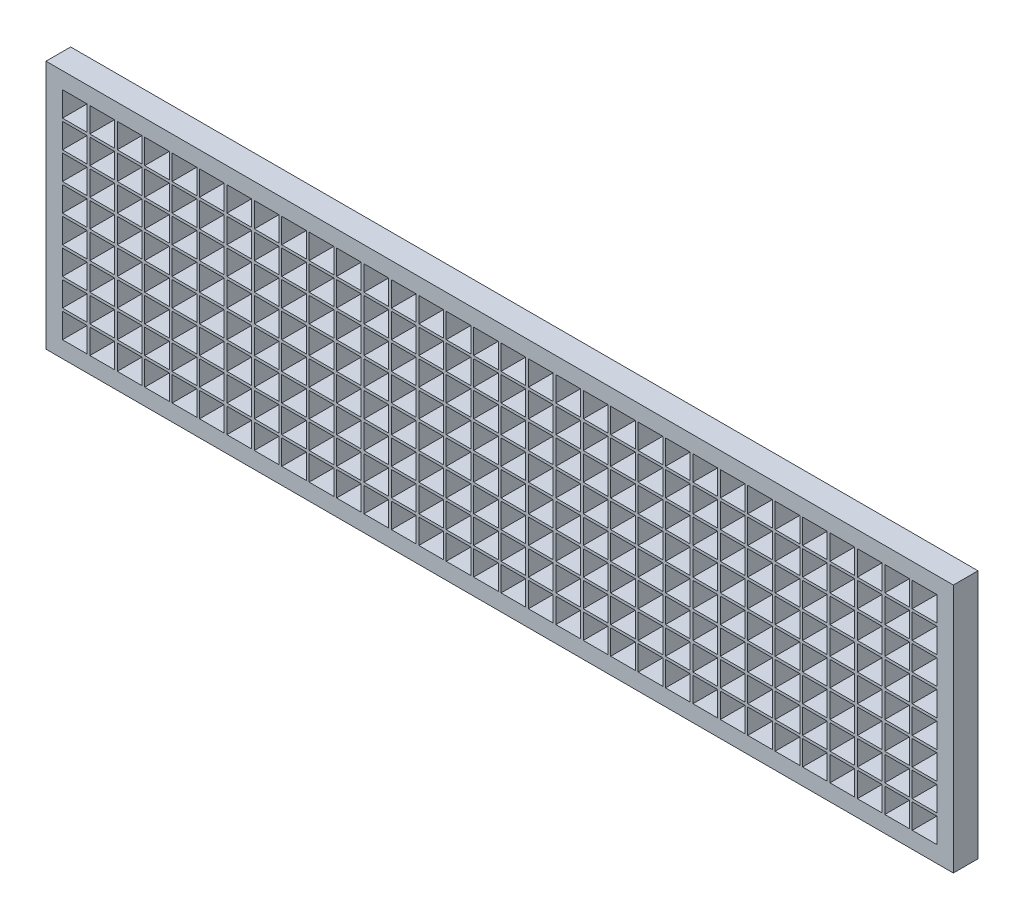
from build123d import *

# Parameters (mm, degrees)
SKETCH_1_W      = 165.5
SKETCH_1_H      = 45.5
SKETCH_1_W_2    = 4.5
SKETCH_1_H_2    = 4.5
EXTRUDE_1_DEPTH = 4.5


with BuildPart() as part:
    # 草图1 → 凸台-拉伸1 (new body)
    with BuildSketch(Plane.XY):
        with Locations((52.859756098, 21.231707317)):
            Rectangle(SKETCH_1_W, SKETCH_1_H)
        with Locations((-24.640243902, 3.731707317)):
            Rectangle(SKETCH_1_W_2, SKETCH_1_H_2, mode=Mode.SUBTRACT)
        with Locations((-19.640243902, 3.731707317)):
            Rectangle(SKETCH_1_W_2, SKETCH_1_H_2, mode=Mode.SUBTRACT)
        with Locations((-14.640243902, 3.731707317)):
            Rectangle(SKETCH_1_W_2, SKETCH_1_H_2, mode=Mode.SUBTRACT)
        with Locations((-9.640243902, 3.731707317)):
            Rectangle(SKETCH_1_W_2, SKETCH_1_H_2, mode=Mode.SUBTRACT)
        with Locations((-4.640243902, 3.731707317)):
            Rectangle(SKETCH_1_W_2, SKETCH_1_H_2, mode=Mode.SUBTRACT)
        with Locations((0.359756098, 3.731707317)):
            Rectangle(SKETCH_1_W_2, SKETCH_1_H_2, mode=Mode.SUBTRACT)
        with Locations((5.359756098, 3.731707317)):
            Rectangle(SKETCH_1_W_2, SKETCH_1_H_2, mode=Mode.SUBTRACT)
        with Locations((10.359756098, 3.731707317)):
            Rectangle(SKETCH_1_W_2, SKETCH_1_H_2, mode=Mode.SUBTRACT)
        with Locations((-24.640243902, 8.731707317)):
            Rectangle(SKETCH_1_W_2, SKETCH_1_H_2, mode=Mode.SUBTRACT)
        with Locations((-19.640243902, 8.731707317)):
            Rectangle(SKETCH_1_W_2, SKETCH_1_H_2, mode=Mode.SUBTRACT)
        with Locations((-14.640243902, 8.731707317)):
            Rectangle(SKETCH_1_W_2, SKETCH_1_H_2, mode=Mode.SUBTRACT)
        with Locations((-9.640243902, 8.731707317)):
            Rectangle(SKETCH_1_W_2, SKETCH_1_H_2, mode=Mode.SUBTRACT)
        with Locations((-4.640243902, 8.731707317)):
            Rectangle(SKETCH_1_W_2, SKETCH_1_H_2, mode=Mode.SUBTRACT)
        with Locations((0.359756098, 8.731707317)):
            Rectangle(SKETCH_1_W_2, SKETCH_1_H_2, mode=Mode.SUBTRACT)
        with Locations((5.359756098, 8.731707317)):
            Rectangle(SKETCH_1_W_2, SKETCH_1_H_2, mode=Mode.SUBTRACT)
        with Locations((10.359756098, 8.731707317)):
            Rectangle(SKETCH_1_W_2, SKETCH_1_H_2, mode=Mode.SUBTRACT)
        with Locations((15.359756098, 3.731707317)):
            Rectangle(SKETCH_1_W_2, SKETCH_1_H_2, mode=Mode.SUBTRACT)
        with Locations((20.359756098, 3.731707317)):
            Rectangle(SKETCH_1_W_2, SKETCH_1_H_2, mode=Mode.SUBTRACT)
        with Locations((25.359756098, 3.731707317)):
            Rectangle(SKETCH_1_W_2, SKETCH_1_H_2, mode=Mode.SUBTRACT)
        with Locations((30.359756098, 3.731707317)):
            Rectangle(SKETCH_1_W_2, SKETCH_1_H_2, mode=Mode.SUBTRACT)
        with Locations((35.359756098, 3.731707317)):
            Rectangle(SKETCH_1_W_2, SKETCH_1_H_2, mode=Mode.SUBTRACT)
        with Locations((40.359756098, 3.731707317)):
            Rectangle(SKETCH_1_W_2, SKETCH_1_H_2, mode=Mode.SUBTRACT)
        with Locations((45.359756098, 3.731707317)):
            Rectangle(SKETCH_1_W_2, SKETCH_1_H_2, mode=Mode.SUBTRACT)
        with Locations((50.359756098, 3.731707317)):
            Rectangle(SKETCH_1_W_2, SKETCH_1_H_2, mode=Mode.SUBTRACT)
        with Locations((15.359756098, 8.731707317)):
            Rectangle(SKETCH_1_W_2, SKETCH_1_H_2, mode=Mode.SUBTRACT)
        with Locations((20.359756098, 8.731707317)):
            Rectangle(SKETCH_1_W_2, SKETCH_1_H_2, mode=Mode.SUBTRACT)
        with Locations((25.359756098, 8.731707317)):
            Rectangle(SKETCH_1_W_2, SKETCH_1_H_2, mode=Mode.SUBTRACT)
        with Locations((30.359756098, 8.731707317)):
            Rectangle(SKETCH_1_W_2, SKETCH_1_H_2, mode=Mode.SUBTRACT)
        with Locations((35.359756098, 8.731707317)):
            Rectangle(SKETCH_1_W_2, SKETCH_1_H_2, mode=Mode.SUBTRACT)
        with Locations((40.359756098, 8.731707317)):
            Rectangle(SKETCH_1_W_2, SKETCH_1_H_2, mode=Mode.SUBTRACT)
        with Locations((45.359756098, 8.731707317)):
            Rectangle(SKETCH_1_W_2, SKETCH_1_H_2, mode=Mode.SUBTRACT)
        with Locations((50.359756098, 8.731707317)):
            Rectangle(SKETCH_1_W_2, SKETCH_1_H_2, mode=Mode.SUBTRACT)
        with Locations((-24.640243902, 13.731707317)):
            Rectangle(SKETCH_1_W_2, SKETCH_1_H_2, mode=Mode.SUBTRACT)
        with Locations((-19.640243902, 13.731707317)):
            Rectangle(SKETCH_1_W_2, SKETCH_1_H_2, mode=Mode.SUBTRACT)
        with Locations((-14.640243902, 13.731707317)):
            Rectangle(SKETCH_1_W_2, SKETCH_1_H_2, mode=Mode.SUBTRACT)
        with Locations((-9.640243902, 13.731707317)):
            Rectangle(SKETCH_1_W_2, SKETCH_1_H_2, mode=Mode.SUBTRACT)
        with Locations((-4.640243902, 13.731707317)):
            Rectangle(SKETCH_1_W_2, SKETCH_1_H_2, mode=Mode.SUBTRACT)
        with Locations((0.359756098, 13.731707317)):
            Rectangle(SKETCH_1_W_2, SKETCH_1_H_2, mode=Mode.SUBTRACT)
        with Locations((5.359756098, 13.731707317)):
            Rectangle(SKETCH_1_W_2, SKETCH_1_H_2, mode=Mode.SUBTRACT)
        with Locations((10.359756098, 13.731707317)):
            Rectangle(SKETCH_1_W_2, SKETCH_1_H_2, mode=Mode.SUBTRACT)
        with Locations((-24.640243902, 18.731707317)):
            Rectangle(SKETCH_1_W_2, SKETCH_1_H_2, mode=Mode.SUBTRACT)
        with Locations((-19.640243902, 18.731707317)):
            Rectangle(SKETCH_1_W_2, SKETCH_1_H_2, mode=Mode.SUBTRACT)
        with Locations((-14.640243902, 18.731707317)):
            Rectangle(SKETCH_1_W_2, SKETCH_1_H_2, mode=Mode.SUBTRACT)
        with Locations((-9.640243902, 18.731707317)):
            Rectangle(SKETCH_1_W_2, SKETCH_1_H_2, mode=Mode.SUBTRACT)
        with Locations((-4.640243902, 18.731707317)):
            Rectangle(SKETCH_1_W_2, SKETCH_1_H_2, mode=Mode.SUBTRACT)
        with Locations((0.359756098, 18.731707317)):
            Rectangle(SKETCH_1_W_2, SKETCH_1_H_2, mode=Mode.SUBTRACT)
        with Locations((5.359756098, 18.731707317)):
            Rectangle(SKETCH_1_W_2, SKETCH_1_H_2, mode=Mode.SUBTRACT)
        with Locations((10.359756098, 18.731707317)):
            Rectangle(SKETCH_1_W_2, SKETCH_1_H_2, mode=Mode.SUBTRACT)
        with Locations((15.359756098, 13.731707317)):
            Rectangle(SKETCH_1_W_2, SKETCH_1_H_2, mode=Mode.SUBTRACT)
        with Locations((20.359756098, 13.731707317)):
            Rectangle(SKETCH_1_W_2, SKETCH_1_H_2, mode=Mode.SUBTRACT)
        with Locations((25.359756098, 13.731707317)):
            Rectangle(SKETCH_1_W_2, SKETCH_1_H_2, mode=Mode.SUBTRACT)
        with Locations((30.359756098, 13.731707317)):
            Rectangle(SKETCH_1_W_2, SKETCH_1_H_2, mode=Mode.SUBTRACT)
        with Locations((35.359756098, 13.731707317)):
            Rectangle(SKETCH_1_W_2, SKETCH_1_H_2, mode=Mode.SUBTRACT)
        with Locations((40.359756098, 13.731707317)):
            Rectangle(SKETCH_1_W_2, SKETCH_1_H_2, mode=Mode.SUBTRACT)
        with Locations((45.359756098, 13.731707317)):
            Rectangle(SKETCH_1_W_2, SKETCH_1_H_2, mode=Mode.SUBTRACT)
        with Locations((50.359756098, 13.731707317)):
            Rectangle(SKETCH_1_W_2, SKETCH_1_H_2, mode=Mode.SUBTRACT)
        with Locations((15.359756098, 18.731707317)):
            Rectangle(SKETCH_1_W_2, SKETCH_1_H_2, mode=Mode.SUBTRACT)
        with Locations((20.359756098, 18.731707317)):
            Rectangle(SKETCH_1_W_2, SKETCH_1_H_2, mode=Mode.SUBTRACT)
        with Locations((25.359756098, 18.731707317)):
            Rectangle(SKETCH_1_W_2, SKETCH_1_H_2, mode=Mode.SUBTRACT)
        with Locations((30.359756098, 18.731707317)):
            Rectangle(SKETCH_1_W_2, SKETCH_1_H_2, mode=Mode.SUBTRACT)
        with Locations((35.359756098, 18.731707317)):
            Rectangle(SKETCH_1_W_2, SKETCH_1_H_2, mode=Mode.SUBTRACT)
        with Locations((40.359756098, 18.731707317)):
            Rectangle(SKETCH_1_W_2, SKETCH_1_H_2, mode=Mode.SUBTRACT)
        with Locations((45.359756098, 18.731707317)):
            Rectangle(SKETCH_1_W_2, SKETCH_1_H_2, mode=Mode.SUBTRACT)
        with Locations((50.359756098, 18.731707317)):
            Rectangle(SKETCH_1_W_2, SKETCH_1_H_2, mode=Mode.SUBTRACT)
        with Locations((55.359756098, 3.731707317)):
            Rectangle(SKETCH_1_W_2, SKETCH_1_H_2, mode=Mode.SUBTRACT)
        with Locations((60.359756098, 3.731707317)):
            Rectangle(SKETCH_1_W_2, SKETCH_1_H_2, mode=Mode.SUBTRACT)
        with Locations((65.359756098, 3.731707317)):
            Rectangle(SKETCH_1_W_2, SKETCH_1_H_2, mode=Mode.SUBTRACT)
        with Locations((70.359756098, 3.731707317)):
            Rectangle(SKETCH_1_W_2, SKETCH_1_H_2, mode=Mode.SUBTRACT)
        with Locations((75.359756098, 3.731707317)):
            Rectangle(SKETCH_1_W_2, SKETCH_1_H_2, mode=Mode.SUBTRACT)
        with Locations((80.359756098, 3.731707317)):
            Rectangle(SKETCH_1_W_2, SKETCH_1_H_2, mode=Mode.SUBTRACT)
        with Locations((85.359756098, 3.731707317)):
            Rectangle(SKETCH_1_W_2, SKETCH_1_H_2, mode=Mode.SUBTRACT)
        with Locations((90.359756098, 3.731707317)):
            Rectangle(SKETCH_1_W_2, SKETCH_1_H_2, mode=Mode.SUBTRACT)
        with Locations((55.359756098, 8.731707317)):
            Rectangle(SKETCH_1_W_2, SKETCH_1_H_2, mode=Mode.SUBTRACT)
        with Locations((60.359756098, 8.731707317)):
            Rectangle(SKETCH_1_W_2, SKETCH_1_H_2, mode=Mode.SUBTRACT)
        with Locations((65.359756098, 8.731707317)):
            Rectangle(SKETCH_1_W_2, SKETCH_1_H_2, mode=Mode.SUBTRACT)
        with Locations((70.359756098, 8.731707317)):
            Rectangle(SKETCH_1_W_2, SKETCH_1_H_2, mode=Mode.SUBTRACT)
        with Locations((75.359756098, 8.731707317)):
            Rectangle(SKETCH_1_W_2, SKETCH_1_H_2, mode=Mode.SUBTRACT)
        with Locations((80.359756098, 8.731707317)):
            Rectangle(SKETCH_1_W_2, SKETCH_1_H_2, mode=Mode.SUBTRACT)
        with Locations((85.359756098, 8.731707317)):
            Rectangle(SKETCH_1_W_2, SKETCH_1_H_2, mode=Mode.SUBTRACT)
        with Locations((90.359756098, 8.731707317)):
            Rectangle(SKETCH_1_W_2, SKETCH_1_H_2, mode=Mode.SUBTRACT)
        with Locations((95.359756098, 3.731707317)):
            Rectangle(SKETCH_1_W_2, SKETCH_1_H_2, mode=Mode.SUBTRACT)
        with Locations((100.359756098, 3.731707317)):
            Rectangle(SKETCH_1_W_2, SKETCH_1_H_2, mode=Mode.SUBTRACT)
        with Locations((105.359756098, 3.731707317)):
            Rectangle(SKETCH_1_W_2, SKETCH_1_H_2, mode=Mode.SUBTRACT)
        with Locations((110.359756098, 3.731707317)):
            Rectangle(SKETCH_1_W_2, SKETCH_1_H_2, mode=Mode.SUBTRACT)
        with Locations((115.359756098, 3.731707317)):
            Rectangle(SKETCH_1_W_2, SKETCH_1_H_2, mode=Mode.SUBTRACT)
        with Locations((120.359756098, 3.731707317)):
            Rectangle(SKETCH_1_W_2, SKETCH_1_H_2, mode=Mode.SUBTRACT)
        with Locations((125.359756098, 3.731707317)):
            Rectangle(SKETCH_1_W_2, SKETCH_1_H_2, mode=Mode.SUBTRACT)
        with Locations((130.359756098, 3.731707317)):
            Rectangle(SKETCH_1_W_2, SKETCH_1_H_2, mode=Mode.SUBTRACT)
        with Locations((95.359756098, 8.731707317)):
            Rectangle(SKETCH_1_W_2, SKETCH_1_H_2, mode=Mode.SUBTRACT)
        with Locations((100.359756098, 8.731707317)):
            Rectangle(SKETCH_1_W_2, SKETCH_1_H_2, mode=Mode.SUBTRACT)
        with Locations((105.359756098, 8.731707317)):
            Rectangle(SKETCH_1_W_2, SKETCH_1_H_2, mode=Mode.SUBTRACT)
        with Locations((110.359756098, 8.731707317)):
            Rectangle(SKETCH_1_W_2, SKETCH_1_H_2, mode=Mode.SUBTRACT)
        with Locations((115.359756098, 8.731707317)):
            Rectangle(SKETCH_1_W_2, SKETCH_1_H_2, mode=Mode.SUBTRACT)
        with Locations((120.359756098, 8.731707317)):
            Rectangle(SKETCH_1_W_2, SKETCH_1_H_2, mode=Mode.SUBTRACT)
        with Locations((125.359756098, 8.731707317)):
            Rectangle(SKETCH_1_W_2, SKETCH_1_H_2, mode=Mode.SUBTRACT)
        with Locations((130.359756098, 8.731707317)):
            Rectangle(SKETCH_1_W_2, SKETCH_1_H_2, mode=Mode.SUBTRACT)
        with Locations((55.359756098, 13.731707317)):
            Rectangle(SKETCH_1_W_2, SKETCH_1_H_2, mode=Mode.SUBTRACT)
        with Locations((60.359756098, 13.731707317)):
            Rectangle(SKETCH_1_W_2, SKETCH_1_H_2, mode=Mode.SUBTRACT)
        with Locations((65.359756098, 13.731707317)):
            Rectangle(SKETCH_1_W_2, SKETCH_1_H_2, mode=Mode.SUBTRACT)
        with Locations((70.359756098, 13.731707317)):
            Rectangle(SKETCH_1_W_2, SKETCH_1_H_2, mode=Mode.SUBTRACT)
        with Locations((75.359756098, 13.731707317)):
            Rectangle(SKETCH_1_W_2, SKETCH_1_H_2, mode=Mode.SUBTRACT)
        with Locations((80.359756098, 13.731707317)):
            Rectangle(SKETCH_1_W_2, SKETCH_1_H_2, mode=Mode.SUBTRACT)
        with Locations((85.359756098, 13.731707317)):
            Rectangle(SKETCH_1_W_2, SKETCH_1_H_2, mode=Mode.SUBTRACT)
        with Locations((90.359756098, 13.731707317)):
            Rectangle(SKETCH_1_W_2, SKETCH_1_H_2, mode=Mode.SUBTRACT)
        with Locations((55.359756098, 18.731707317)):
            Rectangle(SKETCH_1_W_2, SKETCH_1_H_2, mode=Mode.SUBTRACT)
        with Locations((60.359756098, 18.731707317)):
            Rectangle(SKETCH_1_W_2, SKETCH_1_H_2, mode=Mode.SUBTRACT)
        with Locations((65.359756098, 18.731707317)):
            Rectangle(SKETCH_1_W_2, SKETCH_1_H_2, mode=Mode.SUBTRACT)
        with Locations((70.359756098, 18.731707317)):
            Rectangle(SKETCH_1_W_2, SKETCH_1_H_2, mode=Mode.SUBTRACT)
        with Locations((75.359756098, 18.731707317)):
            Rectangle(SKETCH_1_W_2, SKETCH_1_H_2, mode=Mode.SUBTRACT)
        with Locations((80.359756098, 18.731707317)):
            Rectangle(SKETCH_1_W_2, SKETCH_1_H_2, mode=Mode.SUBTRACT)
        with Locations((85.359756098, 18.731707317)):
            Rectangle(SKETCH_1_W_2, SKETCH_1_H_2, mode=Mode.SUBTRACT)
        with Locations((90.359756098, 18.731707317)):
            Rectangle(SKETCH_1_W_2, SKETCH_1_H_2, mode=Mode.SUBTRACT)
        with Locations((95.359756098, 13.731707317)):
            Rectangle(SKETCH_1_W_2, SKETCH_1_H_2, mode=Mode.SUBTRACT)
        with Locations((100.359756098, 13.731707317)):
            Rectangle(SKETCH_1_W_2, SKETCH_1_H_2, mode=Mode.SUBTRACT)
        with Locations((105.359756098, 13.731707317)):
            Rectangle(SKETCH_1_W_2, SKETCH_1_H_2, mode=Mode.SUBTRACT)
        with Locations((110.359756098, 13.731707317)):
            Rectangle(SKETCH_1_W_2, SKETCH_1_H_2, mode=Mode.SUBTRACT)
        with Locations((115.359756098, 13.731707317)):
            Rectangle(SKETCH_1_W_2, SKETCH_1_H_2, mode=Mode.SUBTRACT)
        with Locations((120.359756098, 13.731707317)):
            Rectangle(SKETCH_1_W_2, SKETCH_1_H_2, mode=Mode.SUBTRACT)
        with Locations((125.359756098, 13.731707317)):
            Rectangle(SKETCH_1_W_2, SKETCH_1_H_2, mode=Mode.SUBTRACT)
        with Locations((130.359756098, 13.731707317)):
            Rectangle(SKETCH_1_W_2, SKETCH_1_H_2, mode=Mode.SUBTRACT)
        with Locations((95.359756098, 18.731707317)):
            Rectangle(SKETCH_1_W_2, SKETCH_1_H_2, mode=Mode.SUBTRACT)
        with Locations((100.359756098, 18.731707317)):
            Rectangle(SKETCH_1_W_2, SKETCH_1_H_2, mode=Mode.SUBTRACT)
        with Locations((105.359756098, 18.731707317)):
            Rectangle(SKETCH_1_W_2, SKETCH_1_H_2, mode=Mode.SUBTRACT)
        with Locations((110.359756098, 18.731707317)):
            Rectangle(SKETCH_1_W_2, SKETCH_1_H_2, mode=Mode.SUBTRACT)
        with Locations((115.359756098, 18.731707317)):
            Rectangle(SKETCH_1_W_2, SKETCH_1_H_2, mode=Mode.SUBTRACT)
        with Locations((120.359756098, 18.731707317)):
            Rectangle(SKETCH_1_W_2, SKETCH_1_H_2, mode=Mode.SUBTRACT)
        with Locations((125.359756098, 18.731707317)):
            Rectangle(SKETCH_1_W_2, SKETCH_1_H_2, mode=Mode.SUBTRACT)
        with Locations((130.359756098, 18.731707317)):
            Rectangle(SKETCH_1_W_2, SKETCH_1_H_2, mode=Mode.SUBTRACT)
        with Locations((-24.640243902, 23.731707317)):
            Rectangle(SKETCH_1_W_2, SKETCH_1_H_2, mode=Mode.SUBTRACT)
        with Locations((-19.640243902, 23.731707317)):
            Rectangle(SKETCH_1_W_2, SKETCH_1_H_2, mode=Mode.SUBTRACT)
        with Locations((-14.640243902, 23.731707317)):
            Rectangle(SKETCH_1_W_2, SKETCH_1_H_2, mode=Mode.SUBTRACT)
        with Locations((-9.640243902, 23.731707317)):
            Rectangle(SKETCH_1_W_2, SKETCH_1_H_2, mode=Mode.SUBTRACT)
        with Locations((-4.640243902, 23.731707317)):
            Rectangle(SKETCH_1_W_2, SKETCH_1_H_2, mode=Mode.SUBTRACT)
        with Locations((0.359756098, 23.731707317)):
            Rectangle(SKETCH_1_W_2, SKETCH_1_H_2, mode=Mode.SUBTRACT)
        with Locations((5.359756098, 23.731707317)):
            Rectangle(SKETCH_1_W_2, SKETCH_1_H_2, mode=Mode.SUBTRACT)
        with Locations((10.359756098, 23.731707317)):
            Rectangle(SKETCH_1_W_2, SKETCH_1_H_2, mode=Mode.SUBTRACT)
        with Locations((-24.640243902, 28.731707317)):
            Rectangle(SKETCH_1_W_2, SKETCH_1_H_2, mode=Mode.SUBTRACT)
        with Locations((-19.640243902, 28.731707317)):
            Rectangle(SKETCH_1_W_2, SKETCH_1_H_2, mode=Mode.SUBTRACT)
        with Locations((-14.640243902, 28.731707317)):
            Rectangle(SKETCH_1_W_2, SKETCH_1_H_2, mode=Mode.SUBTRACT)
        with Locations((-9.640243902, 28.731707317)):
            Rectangle(SKETCH_1_W_2, SKETCH_1_H_2, mode=Mode.SUBTRACT)
        with Locations((-4.640243902, 28.731707317)):
            Rectangle(SKETCH_1_W_2, SKETCH_1_H_2, mode=Mode.SUBTRACT)
        with Locations((0.359756098, 28.731707317)):
            Rectangle(SKETCH_1_W_2, SKETCH_1_H_2, mode=Mode.SUBTRACT)
        with Locations((5.359756098, 28.731707317)):
            Rectangle(SKETCH_1_W_2, SKETCH_1_H_2, mode=Mode.SUBTRACT)
        with Locations((10.359756098, 28.731707317)):
            Rectangle(SKETCH_1_W_2, SKETCH_1_H_2, mode=Mode.SUBTRACT)
        with Locations((15.359756098, 23.731707317)):
            Rectangle(SKETCH_1_W_2, SKETCH_1_H_2, mode=Mode.SUBTRACT)
        with Locations((20.359756098, 23.731707317)):
            Rectangle(SKETCH_1_W_2, SKETCH_1_H_2, mode=Mode.SUBTRACT)
        with Locations((25.359756098, 23.731707317)):
            Rectangle(SKETCH_1_W_2, SKETCH_1_H_2, mode=Mode.SUBTRACT)
        with Locations((30.359756098, 23.731707317)):
            Rectangle(SKETCH_1_W_2, SKETCH_1_H_2, mode=Mode.SUBTRACT)
        with Locations((35.359756098, 23.731707317)):
            Rectangle(SKETCH_1_W_2, SKETCH_1_H_2, mode=Mode.SUBTRACT)
        with Locations((40.359756098, 23.731707317)):
            Rectangle(SKETCH_1_W_2, SKETCH_1_H_2, mode=Mode.SUBTRACT)
        with Locations((45.359756098, 23.731707317)):
            Rectangle(SKETCH_1_W_2, SKETCH_1_H_2, mode=Mode.SUBTRACT)
        with Locations((50.359756098, 23.731707317)):
            Rectangle(SKETCH_1_W_2, SKETCH_1_H_2, mode=Mode.SUBTRACT)
        with Locations((15.359756098, 28.731707317)):
            Rectangle(SKETCH_1_W_2, SKETCH_1_H_2, mode=Mode.SUBTRACT)
        with Locations((20.359756098, 28.731707317)):
            Rectangle(SKETCH_1_W_2, SKETCH_1_H_2, mode=Mode.SUBTRACT)
        with Locations((25.359756098, 28.731707317)):
            Rectangle(SKETCH_1_W_2, SKETCH_1_H_2, mode=Mode.SUBTRACT)
        with Locations((30.359756098, 28.731707317)):
            Rectangle(SKETCH_1_W_2, SKETCH_1_H_2, mode=Mode.SUBTRACT)
        with Locations((35.359756098, 28.731707317)):
            Rectangle(SKETCH_1_W_2, SKETCH_1_H_2, mode=Mode.SUBTRACT)
        with Locations((40.359756098, 28.731707317)):
            Rectangle(SKETCH_1_W_2, SKETCH_1_H_2, mode=Mode.SUBTRACT)
        with Locations((45.359756098, 28.731707317)):
            Rectangle(SKETCH_1_W_2, SKETCH_1_H_2, mode=Mode.SUBTRACT)
        with Locations((50.359756098, 28.731707317)):
            Rectangle(SKETCH_1_W_2, SKETCH_1_H_2, mode=Mode.SUBTRACT)
        with Locations((-24.640243902, 33.731707317)):
            Rectangle(SKETCH_1_W_2, SKETCH_1_H_2, mode=Mode.SUBTRACT)
        with Locations((-19.640243902, 33.731707317)):
            Rectangle(SKETCH_1_W_2, SKETCH_1_H_2, mode=Mode.SUBTRACT)
        with Locations((-14.640243902, 33.731707317)):
            Rectangle(SKETCH_1_W_2, SKETCH_1_H_2, mode=Mode.SUBTRACT)
        with Locations((-9.640243902, 33.731707317)):
            Rectangle(SKETCH_1_W_2, SKETCH_1_H_2, mode=Mode.SUBTRACT)
        with Locations((-4.640243902, 33.731707317)):
            Rectangle(SKETCH_1_W_2, SKETCH_1_H_2, mode=Mode.SUBTRACT)
        with Locations((0.359756098, 33.731707317)):
            Rectangle(SKETCH_1_W_2, SKETCH_1_H_2, mode=Mode.SUBTRACT)
        with Locations((5.359756098, 33.731707317)):
            Rectangle(SKETCH_1_W_2, SKETCH_1_H_2, mode=Mode.SUBTRACT)
        with Locations((10.359756098, 33.731707317)):
            Rectangle(SKETCH_1_W_2, SKETCH_1_H_2, mode=Mode.SUBTRACT)
        with Locations((-24.640243902, 38.731707317)):
            Rectangle(SKETCH_1_W_2, SKETCH_1_H_2, mode=Mode.SUBTRACT)
        with Locations((-19.640243902, 38.731707317)):
            Rectangle(SKETCH_1_W_2, SKETCH_1_H_2, mode=Mode.SUBTRACT)
        with Locations((-14.640243902, 38.731707317)):
            Rectangle(SKETCH_1_W_2, SKETCH_1_H_2, mode=Mode.SUBTRACT)
        with Locations((-9.640243902, 38.731707317)):
            Rectangle(SKETCH_1_W_2, SKETCH_1_H_2, mode=Mode.SUBTRACT)
        with Locations((-4.640243902, 38.731707317)):
            Rectangle(SKETCH_1_W_2, SKETCH_1_H_2, mode=Mode.SUBTRACT)
        with Locations((0.359756098, 38.731707317)):
            Rectangle(SKETCH_1_W_2, SKETCH_1_H_2, mode=Mode.SUBTRACT)
        with Locations((5.359756098, 38.731707317)):
            Rectangle(SKETCH_1_W_2, SKETCH_1_H_2, mode=Mode.SUBTRACT)
        with Locations((10.359756098, 38.731707317)):
            Rectangle(SKETCH_1_W_2, SKETCH_1_H_2, mode=Mode.SUBTRACT)
        with Locations((15.359756098, 33.731707317)):
            Rectangle(SKETCH_1_W_2, SKETCH_1_H_2, mode=Mode.SUBTRACT)
        with Locations((20.359756098, 33.731707317)):
            Rectangle(SKETCH_1_W_2, SKETCH_1_H_2, mode=Mode.SUBTRACT)
        with Locations((25.359756098, 33.731707317)):
            Rectangle(SKETCH_1_W_2, SKETCH_1_H_2, mode=Mode.SUBTRACT)
        with Locations((30.359756098, 33.731707317)):
            Rectangle(SKETCH_1_W_2, SKETCH_1_H_2, mode=Mode.SUBTRACT)
        with Locations((35.359756098, 33.731707317)):
            Rectangle(SKETCH_1_W_2, SKETCH_1_H_2, mode=Mode.SUBTRACT)
        with Locations((40.359756098, 33.731707317)):
            Rectangle(SKETCH_1_W_2, SKETCH_1_H_2, mode=Mode.SUBTRACT)
        with Locations((45.359756098, 33.731707317)):
            Rectangle(SKETCH_1_W_2, SKETCH_1_H_2, mode=Mode.SUBTRACT)
        with Locations((50.359756098, 33.731707317)):
            Rectangle(SKETCH_1_W_2, SKETCH_1_H_2, mode=Mode.SUBTRACT)
        with Locations((15.359756098, 38.731707317)):
            Rectangle(SKETCH_1_W_2, SKETCH_1_H_2, mode=Mode.SUBTRACT)
        with Locations((20.359756098, 38.731707317)):
            Rectangle(SKETCH_1_W_2, SKETCH_1_H_2, mode=Mode.SUBTRACT)
        with Locations((25.359756098, 38.731707317)):
            Rectangle(SKETCH_1_W_2, SKETCH_1_H_2, mode=Mode.SUBTRACT)
        with Locations((30.359756098, 38.731707317)):
            Rectangle(SKETCH_1_W_2, SKETCH_1_H_2, mode=Mode.SUBTRACT)
        with Locations((35.359756098, 38.731707317)):
            Rectangle(SKETCH_1_W_2, SKETCH_1_H_2, mode=Mode.SUBTRACT)
        with Locations((40.359756098, 38.731707317)):
            Rectangle(SKETCH_1_W_2, SKETCH_1_H_2, mode=Mode.SUBTRACT)
        with Locations((45.359756098, 38.731707317)):
            Rectangle(SKETCH_1_W_2, SKETCH_1_H_2, mode=Mode.SUBTRACT)
        with Locations((50.359756098, 38.731707317)):
            Rectangle(SKETCH_1_W_2, SKETCH_1_H_2, mode=Mode.SUBTRACT)
        with Locations((55.359756098, 23.731707317)):
            Rectangle(SKETCH_1_W_2, SKETCH_1_H_2, mode=Mode.SUBTRACT)
        with Locations((60.359756098, 23.731707317)):
            Rectangle(SKETCH_1_W_2, SKETCH_1_H_2, mode=Mode.SUBTRACT)
        with Locations((65.359756098, 23.731707317)):
            Rectangle(SKETCH_1_W_2, SKETCH_1_H_2, mode=Mode.SUBTRACT)
        with Locations((70.359756098, 23.731707317)):
            Rectangle(SKETCH_1_W_2, SKETCH_1_H_2, mode=Mode.SUBTRACT)
        with Locations((75.359756098, 23.731707317)):
            Rectangle(SKETCH_1_W_2, SKETCH_1_H_2, mode=Mode.SUBTRACT)
        with Locations((80.359756098, 23.731707317)):
            Rectangle(SKETCH_1_W_2, SKETCH_1_H_2, mode=Mode.SUBTRACT)
        with Locations((85.359756098, 23.731707317)):
            Rectangle(SKETCH_1_W_2, SKETCH_1_H_2, mode=Mode.SUBTRACT)
        with Locations((90.359756098, 23.731707317)):
            Rectangle(SKETCH_1_W_2, SKETCH_1_H_2, mode=Mode.SUBTRACT)
        with Locations((55.359756098, 28.731707317)):
            Rectangle(SKETCH_1_W_2, SKETCH_1_H_2, mode=Mode.SUBTRACT)
        with Locations((60.359756098, 28.731707317)):
            Rectangle(SKETCH_1_W_2, SKETCH_1_H_2, mode=Mode.SUBTRACT)
        with Locations((65.359756098, 28.731707317)):
            Rectangle(SKETCH_1_W_2, SKETCH_1_H_2, mode=Mode.SUBTRACT)
        with Locations((70.359756098, 28.731707317)):
            Rectangle(SKETCH_1_W_2, SKETCH_1_H_2, mode=Mode.SUBTRACT)
        with Locations((75.359756098, 28.731707317)):
            Rectangle(SKETCH_1_W_2, SKETCH_1_H_2, mode=Mode.SUBTRACT)
        with Locations((80.359756098, 28.731707317)):
            Rectangle(SKETCH_1_W_2, SKETCH_1_H_2, mode=Mode.SUBTRACT)
        with Locations((85.359756098, 28.731707317)):
            Rectangle(SKETCH_1_W_2, SKETCH_1_H_2, mode=Mode.SUBTRACT)
        with Locations((90.359756098, 28.731707317)):
            Rectangle(SKETCH_1_W_2, SKETCH_1_H_2, mode=Mode.SUBTRACT)
        with Locations((95.359756098, 23.731707317)):
            Rectangle(SKETCH_1_W_2, SKETCH_1_H_2, mode=Mode.SUBTRACT)
        with Locations((100.359756098, 23.731707317)):
            Rectangle(SKETCH_1_W_2, SKETCH_1_H_2, mode=Mode.SUBTRACT)
        with Locations((105.359756098, 23.731707317)):
            Rectangle(SKETCH_1_W_2, SKETCH_1_H_2, mode=Mode.SUBTRACT)
        with Locations((110.359756098, 23.731707317)):
            Rectangle(SKETCH_1_W_2, SKETCH_1_H_2, mode=Mode.SUBTRACT)
        with Locations((115.359756098, 23.731707317)):
            Rectangle(SKETCH_1_W_2, SKETCH_1_H_2, mode=Mode.SUBTRACT)
        with Locations((120.359756098, 23.731707317)):
            Rectangle(SKETCH_1_W_2, SKETCH_1_H_2, mode=Mode.SUBTRACT)
        with Locations((125.359756098, 23.731707317)):
            Rectangle(SKETCH_1_W_2, SKETCH_1_H_2, mode=Mode.SUBTRACT)
        with Locations((130.359756098, 23.731707317)):
            Rectangle(SKETCH_1_W_2, SKETCH_1_H_2, mode=Mode.SUBTRACT)
        with Locations((95.359756098, 28.731707317)):
            Rectangle(SKETCH_1_W_2, SKETCH_1_H_2, mode=Mode.SUBTRACT)
        with Locations((100.359756098, 28.731707317)):
            Rectangle(SKETCH_1_W_2, SKETCH_1_H_2, mode=Mode.SUBTRACT)
        with Locations((105.359756098, 28.731707317)):
            Rectangle(SKETCH_1_W_2, SKETCH_1_H_2, mode=Mode.SUBTRACT)
        with Locations((110.359756098, 28.731707317)):
            Rectangle(SKETCH_1_W_2, SKETCH_1_H_2, mode=Mode.SUBTRACT)
        with Locations((115.359756098, 28.731707317)):
            Rectangle(SKETCH_1_W_2, SKETCH_1_H_2, mode=Mode.SUBTRACT)
        with Locations((120.359756098, 28.731707317)):
            Rectangle(SKETCH_1_W_2, SKETCH_1_H_2, mode=Mode.SUBTRACT)
        with Locations((125.359756098, 28.731707317)):
            Rectangle(SKETCH_1_W_2, SKETCH_1_H_2, mode=Mode.SUBTRACT)
        with Locations((130.359756098, 28.731707317)):
            Rectangle(SKETCH_1_W_2, SKETCH_1_H_2, mode=Mode.SUBTRACT)
        with Locations((55.359756098, 33.731707317)):
            Rectangle(SKETCH_1_W_2, SKETCH_1_H_2, mode=Mode.SUBTRACT)
        with Locations((60.359756098, 33.731707317)):
            Rectangle(SKETCH_1_W_2, SKETCH_1_H_2, mode=Mode.SUBTRACT)
        with Locations((65.359756098, 33.731707317)):
            Rectangle(SKETCH_1_W_2, SKETCH_1_H_2, mode=Mode.SUBTRACT)
        with Locations((70.359756098, 33.731707317)):
            Rectangle(SKETCH_1_W_2, SKETCH_1_H_2, mode=Mode.SUBTRACT)
        with Locations((75.359756098, 33.731707317)):
            Rectangle(SKETCH_1_W_2, SKETCH_1_H_2, mode=Mode.SUBTRACT)
        with Locations((80.359756098, 33.731707317)):
            Rectangle(SKETCH_1_W_2, SKETCH_1_H_2, mode=Mode.SUBTRACT)
        with Locations((85.359756098, 33.731707317)):
            Rectangle(SKETCH_1_W_2, SKETCH_1_H_2, mode=Mode.SUBTRACT)
        with Locations((90.359756098, 33.731707317)):
            Rectangle(SKETCH_1_W_2, SKETCH_1_H_2, mode=Mode.SUBTRACT)
        with Locations((55.359756098, 38.731707317)):
            Rectangle(SKETCH_1_W_2, SKETCH_1_H_2, mode=Mode.SUBTRACT)
        with Locations((60.359756098, 38.731707317)):
            Rectangle(SKETCH_1_W_2, SKETCH_1_H_2, mode=Mode.SUBTRACT)
        with Locations((65.359756098, 38.731707317)):
            Rectangle(SKETCH_1_W_2, SKETCH_1_H_2, mode=Mode.SUBTRACT)
        with Locations((70.359756098, 38.731707317)):
            Rectangle(SKETCH_1_W_2, SKETCH_1_H_2, mode=Mode.SUBTRACT)
        with Locations((75.359756098, 38.731707317)):
            Rectangle(SKETCH_1_W_2, SKETCH_1_H_2, mode=Mode.SUBTRACT)
        with Locations((80.359756098, 38.731707317)):
            Rectangle(SKETCH_1_W_2, SKETCH_1_H_2, mode=Mode.SUBTRACT)
        with Locations((85.359756098, 38.731707317)):
            Rectangle(SKETCH_1_W_2, SKETCH_1_H_2, mode=Mode.SUBTRACT)
        with Locations((90.359756098, 38.731707317)):
            Rectangle(SKETCH_1_W_2, SKETCH_1_H_2, mode=Mode.SUBTRACT)
        with Locations((95.359756098, 33.731707317)):
            Rectangle(SKETCH_1_W_2, SKETCH_1_H_2, mode=Mode.SUBTRACT)
        with Locations((100.359756098, 33.731707317)):
            Rectangle(SKETCH_1_W_2, SKETCH_1_H_2, mode=Mode.SUBTRACT)
        with Locations((105.359756098, 33.731707317)):
            Rectangle(SKETCH_1_W_2, SKETCH_1_H_2, mode=Mode.SUBTRACT)
        with Locations((110.359756098, 33.731707317)):
            Rectangle(SKETCH_1_W_2, SKETCH_1_H_2, mode=Mode.SUBTRACT)
        with Locations((115.359756098, 33.731707317)):
            Rectangle(SKETCH_1_W_2, SKETCH_1_H_2, mode=Mode.SUBTRACT)
        with Locations((120.359756098, 33.731707317)):
            Rectangle(SKETCH_1_W_2, SKETCH_1_H_2, mode=Mode.SUBTRACT)
        with Locations((125.359756098, 33.731707317)):
            Rectangle(SKETCH_1_W_2, SKETCH_1_H_2, mode=Mode.SUBTRACT)
        with Locations((130.359756098, 33.731707317)):
            Rectangle(SKETCH_1_W_2, SKETCH_1_H_2, mode=Mode.SUBTRACT)
        with Locations((95.359756098, 38.731707317)):
            Rectangle(SKETCH_1_W_2, SKETCH_1_H_2, mode=Mode.SUBTRACT)
        with Locations((100.359756098, 38.731707317)):
            Rectangle(SKETCH_1_W_2, SKETCH_1_H_2, mode=Mode.SUBTRACT)
        with Locations((105.359756098, 38.731707317)):
            Rectangle(SKETCH_1_W_2, SKETCH_1_H_2, mode=Mode.SUBTRACT)
        with Locations((110.359756098, 38.731707317)):
            Rectangle(SKETCH_1_W_2, SKETCH_1_H_2, mode=Mode.SUBTRACT)
        with Locations((115.359756098, 38.731707317)):
            Rectangle(SKETCH_1_W_2, SKETCH_1_H_2, mode=Mode.SUBTRACT)
        with Locations((120.359756098, 38.731707317)):
            Rectangle(SKETCH_1_W_2, SKETCH_1_H_2, mode=Mode.SUBTRACT)
        with Locations((125.359756098, 38.731707317)):
            Rectangle(SKETCH_1_W_2, SKETCH_1_H_2, mode=Mode.SUBTRACT)
        with Locations((130.359756098, 38.731707317)):
            Rectangle(SKETCH_1_W_2, SKETCH_1_H_2, mode=Mode.SUBTRACT)
    extrude(amount=EXTRUDE_1_DEPTH)


solid = part.part
